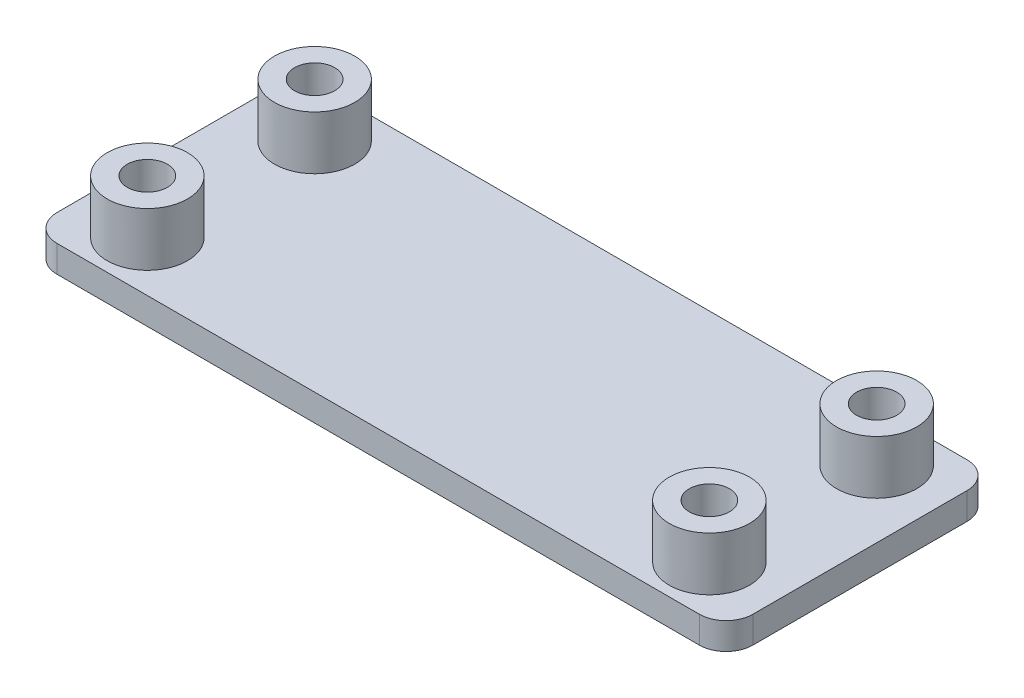
from build123d import *

# Parameters (mm, degrees)
SKETCH1_W           = 52
SKETCH1_H           = 20
BOSS_EXTRUDE1_DEPTH = 2
SKETCH2_R           = 3
SKETCH2_R_2         = 1.5
BOSS_EXTRUDE2_DEPTH = 4
SKETCH3_R           = 1.5
CUT_EXTRUDE1_DEPTH  = 56.856960175
FILLET1_R           = 2


with BuildPart() as part:
    # Sketch1 → Boss-Extrude1 (new body)
    with BuildSketch(Plane(origin=(0, 0, 0), x_dir=(1, 0, 0), z_dir=(0, 1, 0))):
        with Locations((26, 10)):
            Rectangle(SKETCH1_W, SKETCH1_H)
    extrude(amount=BOSS_EXTRUDE1_DEPTH)

    # Sketch2 → Boss-Extrude2 (add)
    # profile 1 of 4: a face of its own
    with BuildSketch(Plane(origin=(0, 2, 0), x_dir=(1, 0, 0), z_dir=(0, 1, 0))):
        with Locations((5, 16.25)):
            Circle(SKETCH2_R)
        with Locations((5, 16.25)):
            Circle(SKETCH2_R_2, mode=Mode.SUBTRACT)
    # profile 2 of 4: a face of its own
    with BuildSketch(Plane(origin=(0, 2, 0), x_dir=(1, 0, 0), z_dir=(0, 1, 0))):
        with Locations((5, 3.75)):
            Circle(SKETCH2_R)
        with Locations((5, 3.75)):
            Circle(SKETCH2_R_2, mode=Mode.SUBTRACT)
    # profile 3 of 4: a face of its own
    with BuildSketch(Plane(origin=(0, 2, 0), x_dir=(1, 0, 0), z_dir=(0, 1, 0))):
        with Locations((47, 3.75)):
            Circle(SKETCH2_R)
        with Locations((47, 3.75)):
            Circle(SKETCH2_R_2, mode=Mode.SUBTRACT)
    # profile 4 of 4: a face of its own
    with BuildSketch(Plane(origin=(0, 2, 0), x_dir=(1, 0, 0), z_dir=(0, 1, 0))):
        with Locations((47, 16.25)):
            Circle(SKETCH2_R)
        with Locations((47, 16.25)):
            Circle(SKETCH2_R_2, mode=Mode.SUBTRACT)
    extrude(amount=BOSS_EXTRUDE2_DEPTH)

    # Sketch3 → Cut-Extrude1 (cut, through all)
    with BuildSketch(Plane(origin=(0, 2, 0), x_dir=(1, 0, 0), z_dir=(0, 1, 0))):
        with Locations((47, 3.75)):
            Circle(SKETCH3_R)
        with Locations((47, 16.25)):
            Circle(SKETCH3_R)
        with Locations((5, 3.75)):
            Circle(SKETCH3_R)
        with Locations((5, 16.25)):
            Circle(SKETCH3_R)
    extrude(amount=-CUT_EXTRUDE1_DEPTH, mode=Mode.SUBTRACT)

    # Fillet1
    fillet1_edges = [part.edges().sort_by_distance(p)[0] for p in [
        (52, 1, 0),
        (52, 1, -20),
        (0, 1, -20),
        (0, 1, 0),
    ]]
    fillet(fillet1_edges, radius=FILLET1_R)


solid = part.part
